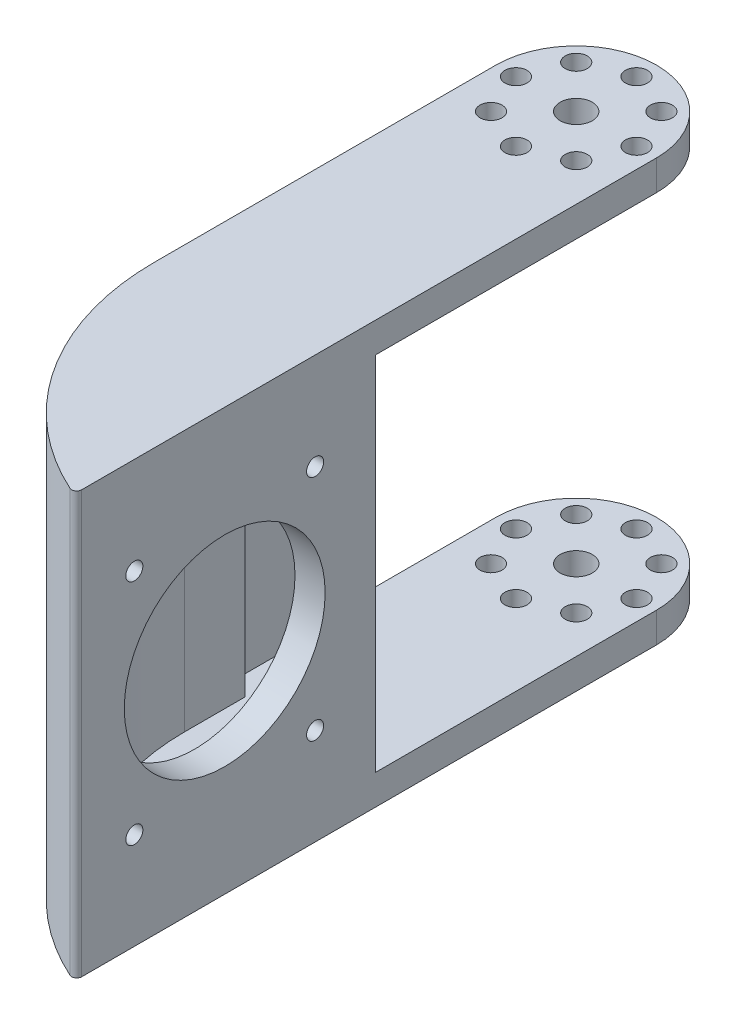
from build123d import *

# Parameters (mm, degrees)
SKETCH_1_R          = 1.1
SKETCH_1_R_2        = 1.6
EXTRUDE_1_DEPTH     = 3
SKETCH_2_R          = 1.6
SKETCH_2_R_2        = 1.1
EXTRUDE_2_DEPTH     = 3
SKETCH_3_W          = 16
SKETCH_3_H          = 36
EXTRUDE_3_DEPTH     = 30
FILLET_1_R          = 26
SKETCH_5_W          = 10
SKETCH_5_H          = 36
EXTRUDE_4_DEPTH     = 1
CUT_EXTRUDE_2_DEPTH = 36
SKETCH_6_R          = 0.85
SKETCH_6_R_2        = 10
CUT_EXTRUDE_1_DEPTH = 3
FILLET_2_R          = 0.5


with BuildPart() as part:
    # ｽｹｯﾁ1 → ﾎﾞｽ - 押し出し1 (new body)
    with BuildSketch(Plane(origin=(0, 0, 0), x_dir=(1, 0, 0), z_dir=(0, 1, 0))):
        with BuildLine():
            Line((-8, 45), (-8, -13))
            Line((-8, -13), (8, -13))
            Line((8, -13), (8, 45))
            ThreePointArc((8, 45), (0, 53), (-8, 45))
        make_face()
        with Locations(Location((0, 51, 0), (0, 0, 270))):
            Circle(SKETCH_1_R, mode=Mode.SUBTRACT)
        with Locations(Location((4.242640687, 49.242640687, 0), (0, 0, 270))):
            Circle(SKETCH_1_R, mode=Mode.SUBTRACT)
        with Locations(Location((6, 45, 0), (0, 0, 270))):
            Circle(SKETCH_1_R, mode=Mode.SUBTRACT)
        with Locations(Location((4.242640687, 40.757359313, 0), (0, 0, 270))):
            Circle(SKETCH_1_R, mode=Mode.SUBTRACT)
        with Locations(Location((0, 39, 0), (0, 0, 270))):
            Circle(SKETCH_1_R, mode=Mode.SUBTRACT)
        with Locations(Location((-4.242640687, 40.757359313, 0), (0, 0, 270))):
            Circle(SKETCH_1_R, mode=Mode.SUBTRACT)
        with Locations(Location((-6, 45, 0), (0, 0, 270))):
            Circle(SKETCH_1_R, mode=Mode.SUBTRACT)
        with Locations(Location((-4.242640687, 49.242640687, 0), (0, 0, 270))):
            Circle(SKETCH_1_R, mode=Mode.SUBTRACT)
        with Locations(Location((0, 45, 0), (0, 0, 270))):
            Circle(SKETCH_1_R_2, mode=Mode.SUBTRACT)
    extrude(amount=EXTRUDE_1_DEPTH)



with BuildPart() as body_2:
    # ｽｹｯﾁ2 → ﾎﾞｽ - 押し出し2 (new body)
    with BuildSketch(Plane(origin=(0, -36, 0), x_dir=(1, 0, 0), z_dir=(0, 1, 0))):
        with BuildLine():
            Line((8, -13), (8, 45))
            ThreePointArc((8, 45), (0, 53), (-8, 45))
            Line((-8, 45), (-8, -13))
            Line((-8, -13), (8, -13))
        make_face()
        with Locations(Location((0, 45, 0), (0, 0, 270))):
            Circle(SKETCH_2_R, mode=Mode.SUBTRACT)
        with Locations(Location((0, 51, 0), (0, 0, 270))):
            Circle(SKETCH_2_R_2, mode=Mode.SUBTRACT)
        with Locations(Location((4.242640687, 49.242640687, 0), (0, 0, 270))):
            Circle(SKETCH_2_R_2, mode=Mode.SUBTRACT)
        with Locations(Location((6, 45, 0), (0, 0, 270))):
            Circle(SKETCH_2_R_2, mode=Mode.SUBTRACT)
        with Locations(Location((4.242640687, 40.757359313, 0), (0, 0, 270))):
            Circle(SKETCH_2_R_2, mode=Mode.SUBTRACT)
        with Locations(Location((0, 39, 0), (0, 0, 270))):
            Circle(SKETCH_2_R_2, mode=Mode.SUBTRACT)
        with Locations(Location((-4.242640687, 40.757359313, 0), (0, 0, 270))):
            Circle(SKETCH_2_R_2, mode=Mode.SUBTRACT)
        with Locations(Location((-6, 45, 0), (0, 0, 270))):
            Circle(SKETCH_2_R_2, mode=Mode.SUBTRACT)
        with Locations(Location((-4.242640687, 49.242640687, 0), (0, 0, 270))):
            Circle(SKETCH_2_R_2, mode=Mode.SUBTRACT)
    extrude(amount=-EXTRUDE_2_DEPTH)


with BuildPart() as part_1:
    add(part.part)

    add(body_2.part)  # ﾎﾞｽ - 押し出し3 merges body 2
    # ｽｹｯﾁ3 → ﾎﾞｽ - 押し出し3 (add)
    with BuildSketch(Plane.XY.offset(13)):
        with Locations((0, -18)):
            Rectangle(SKETCH_3_W, SKETCH_3_H)
    extrude(amount=-EXTRUDE_3_DEPTH)

    # ﾌｨﾚｯﾄ1
    # the kernel refuses this fillet: 26 mm, written as the material it takes off along each edge
    with BuildSketch(Plane(origin=(-8, -99, 13), x_dir=(0, 0, -1), z_dir=(0, 1, 0))) as fillet_1_piece_1:
        with BuildLine():
            CenterArc((24, -26), FILLET_1_R, 90, 67.380135052)
            Line((0, -16), (-0.48, -15.8))
            ThreePointArc((-0.48, -15.8), (-0.52, -8), (-0.52, 0))
            Line((-0.52, 0), (0, 0.52))
            Line((0, 0.52), (24, 0.52))
            Line((24, 0.52), (24, 0))
        make_face()
    extrude(amount=162, mode=Mode.SUBTRACT)

    # ｽｹｯﾁ5 → ﾎﾞｽ - 押し出し4 (add)
    with BuildSketch(Plane.ZY.offset(8)):
        with Locations((-22, -18)):
            Rectangle(SKETCH_5_W, SKETCH_5_H)
    extrude(amount=-EXTRUDE_4_DEPTH)

    # ｽｹｯﾁ7 → ｶｯﾄ - 押し出し2 (cut)
    with BuildSketch(Plane.XZ):
        with BuildLine():
            Line((5, 7.973665961), (5, -17))
            Line((5, -17), (-5, -17))
            Line((-5, -17), (-5, -11))
            ThreePointArc((-5, -11), (-2.346989949, -0.276194705), (5, 7.973665961))
        make_face()
    extrude(amount=CUT_EXTRUDE_2_DEPTH, mode=Mode.SUBTRACT)

    # ｽｹｯﾁ6 → ｶｯﾄ - 押し出し1 (cut)
    with BuildSketch(Plane(origin=(8, 0, 0), x_dir=(0, 0, -1), z_dir=(1, 0, 0))):
        with Locations((11, -6.631182999)):
            Circle(SKETCH_6_R)
        with Locations((-7, -6.631182999)):
            Circle(SKETCH_6_R)
        with Locations((-7, -29.368817001)):
            Circle(SKETCH_6_R)
        with Locations((11, -29.368817001)):
            Circle(SKETCH_6_R)
        with Locations((2, -18)):
            Circle(SKETCH_6_R_2)
    extrude(amount=-CUT_EXTRUDE_1_DEPTH, mode=Mode.SUBTRACT)

    # ﾌｨﾚｯﾄ2
    fillet_2_edges = [part_1.edges().sort_by_distance(p)[0] for p in [
        (8, -18, 13),
    ]]
    fillet(fillet_2_edges, radius=FILLET_2_R)


solid = part_1.part
